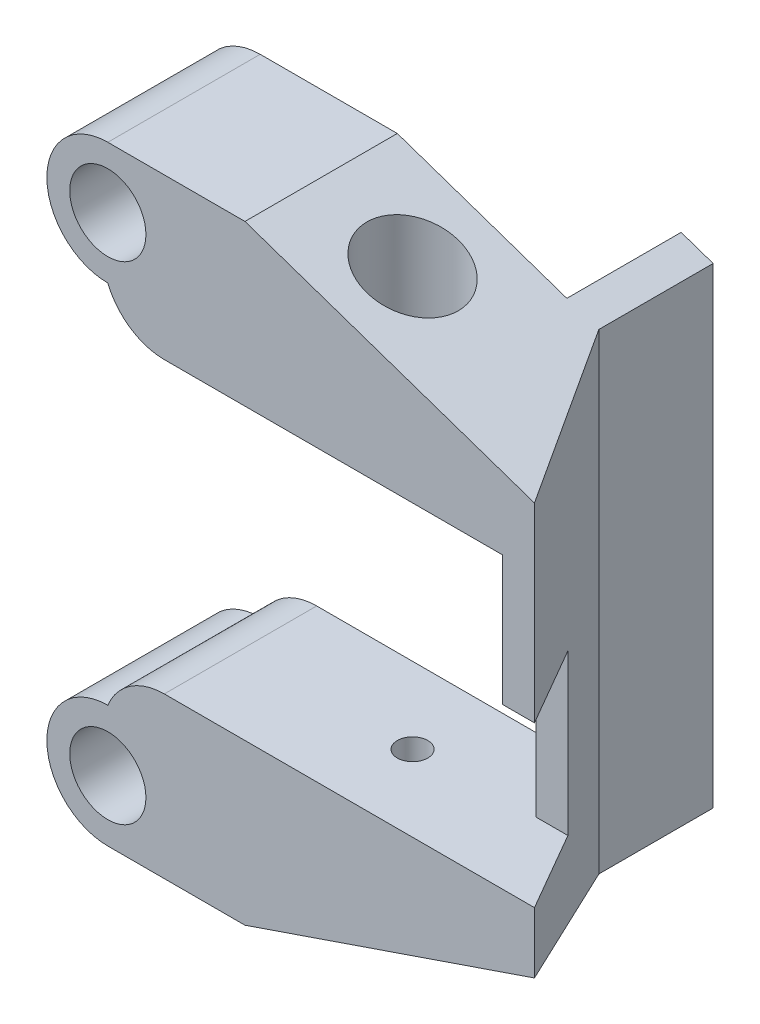
from build123d import *

# Parameters (mm, degrees)
CROQUIS1_R              = 2.5
SALIENTE_EXTRUIR1_DEPTH = 10
CROQUIS2_R              = 1
CORTAR_EXTRUIR1_DEPTH   = 4
SALIENTE_EXTRUIR2_DEPTH = 13.5
CROQUIS4_R              = 3
CORTAR_EXTRUIR2_DEPTH   = 1
SALIENTE_EXTRUIR3_START = 6.5
CROQUIS6_R              = 3
SALIENTE_EXTRUIR3_DEPTH = 6.5
CORTAR_EXTRUIR4_DEPTH   = 10
SALIENTE_EXTRUIR4_DEPTH = 7.5
CROQUIS5_W              = 2.1
CROQUIS5_H              = 10.5
CORTAR_EXTRUIR5_DEPTH   = 6
REDONDEO1_R             = 4
CORTAR_EXTRUIR6_DEPTH   = 1


with BuildPart() as part:
    # Croquis1 → Saliente-Extruir1 (new body)
    with BuildSketch(Plane.XY):
        with BuildLine():
            Line((-103.231635218, 22.700651543), (-131.231635218, 22.700651543))
            Line((-131.231635218, 22.700651543), (-131.231635218, 20.200651543))
            ThreePointArc((-131.231635218, 20.200651543), (-135.231635218, 16.200651543), (-131.231635218, 12.200651543))
            Line((-131.231635218, 12.200651543), (-125.231635218, 12.200651543))
            Line((-125.231635218, 12.200651543), (-125.231635218, 18.700651543))
            Line((-125.231635218, 18.700651543), (-103.231635218, 18.700651543))
            Line((-103.231635218, 18.700651543), (-103.231635218, 22.700651543))
        make_face()
        with Locations((-131.231635218, 16.200651543)):
            Circle(CROQUIS1_R, mode=Mode.SUBTRACT)
    extrude(amount=SALIENTE_EXTRUIR1_DEPTH)

    # Croquis2 → Cortar-Extruir1 (cut)
    with BuildSketch(Plane.XZ.offset(-18.700651543)):
        with Locations(Location((-116.231635218, 5, 0), (0, 0, 270))):
            Circle(CROQUIS2_R)
        Polygon((-103.231635218, 0), (-103.231635218, 10), (-109.00513791, 0), align=None)
    extrude(amount=-CORTAR_EXTRUIR1_DEPTH, mode=Mode.SUBTRACT)

    # Croquis3 → Saliente-Extruir2 (add)
    with BuildSketch(Plane.XZ.offset(-18.700651543)):
        Polygon((-103.231635218, 10), (-105.331635218, 10), (-111.10513791, 0), (-109.00513791, 0), align=None)
    extrude(amount=-SALIENTE_EXTRUIR2_DEPTH)

    # Croquis4 → Cortar-Extruir2 (cut)
    with BuildSketch(Plane.XZ.offset(-18.700651543)):
        with Locations(Location((-116.231635218, 5, 0), (0, 0, 270))):
            Circle(CROQUIS4_R)
    extrude(amount=-CORTAR_EXTRUIR2_DEPTH, mode=Mode.SUBTRACT)

    # Croquis6 → Saliente-Extruir3 (add)
    with BuildSketch(Plane.XZ.offset(-18.700651543).offset(SALIENTE_EXTRUIR3_START)):
        Polygon((-125.231635218, 10), (-103.231635218, 10), (-109.00513791, 0), (-125.231635218, 0), align=None)
        with Locations(Location((-116.231635218, 5, 0), (0, 0, 270))):
            Circle(CROQUIS6_R, mode=Mode.SUBTRACT)
    extrude(amount=-SALIENTE_EXTRUIR3_DEPTH)

    # Croquis7 → Cortar-Extruir4 (cut)
    with BuildSketch(Plane.XY.offset(10)):
        Polygon((-103.231635218, 18.700651543), (-103.231635218, 12.200651543), (-122.231635218, 12.200651543), align=None)
    extrude(amount=-CORTAR_EXTRUIR4_DEPTH, mode=Mode.SUBTRACT)

    # Croquis8 → Saliente-Extruir4 (add)
    with BuildSketch(Plane(origin=(0, 0, 0), x_dir=(-1, 0, 0), z_dir=(0, 0, -1))):
        Polygon((109.00513791, 16.725505885), (109.00513791, 32.200651543), (111.10513791, 32.200651543), (111.10513791, 22.700651543), (111.10513791, 16.007084832), align=None)
    extrude(amount=SALIENTE_EXTRUIR4_DEPTH)

    # Simetría1: part across plane


with BuildPart() as part_1:
    add(part.part)
    add(part.part.mirror(Plane(origin=(0, 32.200651543, 0), x_dir=(0, 0, 1), z_dir=(0, -1, 0))))

    # Croquis5 → Cortar-Extruir5 (cut, along a direction that is not the sketch's normal)
    with BuildSketch(Plane.XY.offset(10)):
        with Locations((-104.281635218, 27.950651543)):
            Rectangle(CROQUIS5_W, CROQUIS5_H)
    extrude(amount=-CORTAR_EXTRUIR5_DEPTH, dir=(0.49999999999999517, 0, 0.8660254037844416), mode=Mode.SUBTRACT)

    # Redondeo1
    # the kernel refuses this fillet: 4 mm, written as the material it takes off along each edge
    with BuildSketch(Plane(origin=(-131.231635218, 41.700651543, -9.270248109), x_dir=(1, 0, 0), z_dir=(0, 0, 1))) as redondeo1_piece_1:
        with BuildLine():
            CenterArc((3.708099244, 4), REDONDEO1_R, 202.024312837, 67.975687163)
            Line((0, 2.5), (-0.074161985, 2.47))
            ThreePointArc((-0.074161985, 2.47), (-0.08, 1.25), (-0.08, 0))
            Line((-0.08, 0), (0, -0.08))
            Line((0, -0.08), (3.708099244, -0.08))
            Line((3.708099244, -0.08), (3.708099244, 0))
        make_face()
    extrude(amount=28.540496218, mode=Mode.SUBTRACT)
    with BuildSketch(Plane(origin=(-131.231635218, 22.700651543, -9.270248109), x_dir=(0, -1, 0), z_dir=(0, 0, 1))) as redondeo1_piece_2:
        with BuildLine():
            CenterArc((4, 3.708099244), REDONDEO1_R, 180, 67.975687163)
            Line((0, 3.708099244), (-0.08, 3.708099244))
            Line((-0.08, 3.708099244), (-0.08, 0))
            Line((-0.08, 0), (0, -0.08))
            ThreePointArc((0, -0.08), (1.25, -0.08), (2.47, -0.074161985))
            Line((2.47, -0.074161985), (2.5, 0))
        make_face()
    extrude(amount=28.540496218, mode=Mode.SUBTRACT)

    # Croquis9 → Cortar-Extruir6 (cut)
    # profile 1 of 3: a face of its own
    with BuildSketch(Plane.XZ.offset(-12.200651543)):
        with BuildLine():
            Line((-129.629918872, 5.935122427), (-129.944021436, 5.935122427))
            add(Edge.make_bspline(
                [(-129.944021436, 5.935122427), (-129.938883042, 5.964665651), (-129.928758908, 6.02287442), (-129.905688863, 6.107276322), (-129.874967246, 6.187004747), (-129.83900153, 6.263031642), (-129.794886252, 6.333998224), (-129.74528823, 6.401172673), (-129.687657927, 6.462870513), (-129.62507573, 6.520799641), (-129.557590268, 6.57340625), (-129.485484513, 6.618077576), (-129.410971743, 6.65712632), (-129.33308236, 6.688820457), (-129.251878521, 6.712367599), (-129.168264744, 6.730083696), (-129.081456362, 6.740880916), (-129.022544442, 6.742163029), (-128.99259916, 6.742814735)],
                knots=[0, 0, 0, 0, 1.053304757, 2.075317675, 3.068179183, 4.052514018, 5.025721787, 5.999656851, 6.981831287, 7.987213101, 8.994102963, 9.982949043, 10.963611807, 11.947192756, 12.931972798, 13.930523328, 14.948072636, 16, 16, 16, 16], degree=3))
            add(Edge.make_bspline(
                [(-128.99259916, 6.742814735), (-128.96100797, 6.741994513), (-128.898998671, 6.740384525), (-128.808193364, 6.728082177), (-128.721593422, 6.708894122), (-128.639379859, 6.68043288), (-128.561767782, 6.643941332), (-128.487896037, 6.599988506), (-128.418237898, 6.548176568), (-128.354426012, 6.487683305), (-128.295418928, 6.422247703), (-128.243758511, 6.351249252), (-128.201485798, 6.274965016), (-128.164802669, 6.195422432), (-128.13779643, 6.110566672), (-128.118009085, 6.021431014), (-128.106974188, 5.927685157), (-128.1051879, 5.86386874), (-128.104277846, 5.831356402)],
                knots=[0, 0, 0, 0, 1.062315377, 2.085183558, 3.076853664, 4.041450855, 5.005054491, 5.956881831, 6.928532668, 7.918549963, 8.909565511, 9.889228988, 10.864308296, 11.838912148, 12.830831495, 13.853185998, 14.906269772, 16, 16, 16, 16], degree=3))
            add(Edge.make_bspline(
                [(-128.104277846, 5.831356402), (-128.105740586, 5.788957882), (-128.108582872, 5.706572285), (-128.131064334, 5.587863343), (-128.169300869, 5.478866679), (-128.214016218, 5.395753244), (-128.258483191, 5.334384337), (-128.297300103, 5.289484954), (-128.341464007, 5.24529324), (-128.391466505, 5.202513595), (-128.447199469, 5.161152722), (-128.508257397, 5.12080561), (-128.574241111, 5.08021957), (-128.621303445, 5.055848386), (-128.645543872, 5.043295504)],
                knots=[0, 0, 0, 0, 1.499598844, 2.913907084, 4.255683563, 5.573052951, 6.236393449, 6.934250511, 7.671053759, 8.445154725, 9.260560518, 10.125260916, 11.034376938, 12, 12, 12, 12], degree=3))
            add(Edge.make_bspline(
                [(-128.645543872, 5.043295504), (-128.609624273, 5.018890314), (-128.539462046, 4.971219334), (-128.446945169, 4.887112245), (-128.369318843, 4.795026922), (-128.304333176, 4.696406998), (-128.255285105, 4.589069905), (-128.219110852, 4.474759076), (-128.197888084, 4.35254157), (-128.195328604, 4.268638268), (-128.194021436, 4.225787491)],
                knots=[0, 0, 0, 0, 1.064624726, 2.079545519, 3.056122326, 4.013672591, 4.968126873, 5.942090367, 6.948992187, 8, 8, 8, 8], degree=3))
            add(Edge.make_bspline(
                [(-128.194021436, 4.225787491), (-128.195906334, 4.17446935), (-128.199629042, 4.073115064), (-128.229453505, 3.924004613), (-128.278213334, 3.780815095), (-128.345370536, 3.644177702), (-128.43022182, 3.517535509), (-128.530361177, 3.402664729), (-128.646540118, 3.302605755), (-128.775951959, 3.217421647), (-128.915393941, 3.148907903), (-129.061941253, 3.099425805), (-129.214050576, 3.068810758), (-129.317544229, 3.065167298), (-129.369802686, 3.063327556)],
                knots=[0, 0, 0, 0, 1.004874671, 1.984646221, 2.966438109, 3.961709977, 4.958676373, 5.945134406, 6.938497793, 7.953256374, 8.973116323, 9.973725145, 10.976845487, 12, 12, 12, 12], degree=3))
            add(Edge.make_bspline(
                [(-129.369802686, 3.063327556), (-129.403024527, 3.064164518), (-129.468283499, 3.065808596), (-129.564297919, 3.077931179), (-129.656379342, 3.098103693), (-129.744676638, 3.127068828), (-129.828882177, 3.164362015), (-129.909517526, 3.209514249), (-129.985885063, 3.263035151), (-130.05829591, 3.323914324), (-130.124708683, 3.392559281), (-130.184585111, 3.467937946), (-130.237361729, 3.549686336), (-130.282974099, 3.637768075), (-130.32167056, 3.731793837), (-130.352227335, 3.832405381), (-130.377195269, 3.938922482), (-130.387483257, 4.012775547), (-130.392739385, 4.050507043)],
                knots=[0, 0, 0, 0, 1.015592156, 1.994967694, 2.953714725, 3.89374535, 4.831137841, 5.76533834, 6.714853956, 7.678276274, 8.653576723, 9.630054425, 10.617115938, 11.623871201, 12.658910274, 13.721192194, 14.835758172, 16, 16, 16, 16], degree=3))
            Line((-130.392739385, 4.050507043), (-130.078636821, 4.050507043))
            add(Edge.make_bspline(
                [(-130.078636821, 4.050507043), (-130.071817316, 4.011337383), (-130.058965267, 3.937518181), (-130.030843292, 3.835188084), (-129.997903045, 3.747213231), (-129.957156351, 3.67270531), (-129.90768096, 3.60887334), (-129.849073899, 3.552813239), (-129.780527485, 3.502546723), (-129.703885102, 3.458636867), (-129.621209749, 3.421740201), (-129.534607726, 3.397536002), (-129.446716354, 3.379693518), (-129.387189113, 3.378188681), (-129.357182494, 3.37743012)],
                knots=[0, 0, 0, 0, 1.310091687, 2.469000878, 3.493463796, 4.400459837, 5.257309936, 6.145490497, 7.065451012, 8.052643887, 9.053215749, 10.040649124, 11.012326184, 12, 12, 12, 12], degree=3))
            add(Edge.make_bspline(
                [(-129.357182494, 3.37743012), (-129.330259871, 3.378259293), (-129.277083775, 3.37989703), (-129.198406779, 3.392370589), (-129.121840554, 3.411955838), (-129.046940427, 3.439301399), (-128.97450054, 3.475723737), (-128.9035768, 3.518933574), (-128.835320775, 3.570956375), (-128.769362567, 3.62897648), (-128.708788832, 3.692455272), (-128.655043055, 3.758415554), (-128.609885092, 3.826322221), (-128.571973544, 3.895642435), (-128.544515813, 3.967894654), (-128.522646763, 4.040786693), (-128.510740558, 4.116022853), (-128.509001035, 4.166622349), (-128.508124, 4.192133645)],
                knots=[0, 0, 0, 0, 0.998765887, 1.972707914, 2.948771611, 3.928374012, 4.925217491, 5.953083336, 7.006002037, 8.105848567, 9.210029586, 10.258437752, 11.259122355, 12.233064382, 13.183315866, 14.122098927, 15.053198292, 16, 16, 16, 16], degree=3))
            add(Edge.make_bspline(
                [(-128.508124, 4.192133645), (-128.50933446, 4.224937482), (-128.511732813, 4.28993358), (-128.530966564, 4.385246302), (-128.563942253, 4.476097655), (-128.608603591, 4.562148174), (-128.66502214, 4.641710436), (-128.734172745, 4.710904056), (-128.813610828, 4.770806342), (-128.905488395, 4.819359607), (-129.010211791, 4.857362123), (-129.128870907, 4.884243366), (-129.262337384, 4.900087257), (-129.356201671, 4.902042819), (-129.405559898, 4.903071145)],
                knots=[0, 0, 0, 0, 0.91172544, 1.806453237, 2.690400502, 3.591501907, 4.495060705, 5.391179975, 6.301027311, 7.251780241, 8.269539355, 9.39038931, 10.627744823, 12, 12, 12, 12], degree=3))
            Line((-129.405559898, 4.903071145), (-129.367699321, 5.217173709))
            Line((-129.367699321, 5.217173709), (-129.275151244, 5.214369222))
            add(Edge.make_bspline(
                [(-129.275151244, 5.214369222), (-129.244045513, 5.214835142), (-129.183095607, 5.215748085), (-129.093779738, 5.225040347), (-129.008955897, 5.240395569), (-128.928749103, 5.261398134), (-128.853234664, 5.287877039), (-128.782576856, 5.321092986), (-128.716565385, 5.3605969), (-128.655172607, 5.40502628), (-128.599942334, 5.45405434), (-128.551350696, 5.505773723), (-128.510265765, 5.560330183), (-128.476330401, 5.616769912), (-128.451011774, 5.676196456), (-128.431790399, 5.737127962), (-128.420167179, 5.801000612), (-128.418981796, 5.844396342), (-128.41838041, 5.866412491)],
                knots=[0, 0, 0, 0, 1.24628212, 2.442018811, 3.593922291, 4.698034728, 5.761554064, 6.796478033, 7.821307851, 8.840472263, 9.829094753, 10.776759556, 11.679673515, 12.561550013, 13.408929098, 14.262137482, 15.118322481, 16, 16, 16, 16], degree=3))
            add(Edge.make_bspline(
                [(-128.41838041, 5.866412491), (-128.418977739, 5.885829602), (-128.420148429, 5.923884725), (-128.427649874, 5.97997183), (-128.442105983, 6.033363927), (-128.460924215, 6.084607044), (-128.484841589, 6.133827975), (-128.515461512, 6.179872626), (-128.550600406, 6.224473146), (-128.591139948, 6.266115067), (-128.635341601, 6.304338892), (-128.682714244, 6.337427885), (-128.732136821, 6.365778381), (-128.784164026, 6.389161078), (-128.839296799, 6.406557697), (-128.896801024, 6.419069311), (-128.956623942, 6.427007735), (-128.997248746, 6.428138858), (-129.017839545, 6.428712171)],
                knots=[0, 0, 0, 0, 1.017722485, 1.994609554, 2.957110515, 3.910372255, 4.852475095, 5.817233168, 6.802300924, 7.824362143, 8.857880086, 9.860231714, 10.847656914, 11.840006958, 12.84318132, 13.87138813, 14.921106966, 16, 16, 16, 16], degree=3))
            add(Edge.make_bspline(
                [(-129.017839545, 6.428712171), (-129.055613795, 6.427179704), (-129.129480711, 6.424182991), (-129.236059233, 6.398210301), (-129.334481261, 6.355534619), (-129.423318067, 6.296764979), (-129.500130155, 6.22388643), (-129.561534995, 6.138410596), (-129.606003859, 6.041072772), (-129.621814699, 5.971026229), (-129.629918872, 5.935122427)],
                knots=[0, 0, 0, 0, 1.055739269, 2.064480543, 3.048501583, 4.044208126, 5.029380081, 5.994799901, 6.972193286, 8, 8, 8, 8], degree=3))
        make_face()
    # profile 2 of 3: a face of its own
    with BuildSketch(Plane.XZ.offset(-12.200651543)):
        with BuildLine():
            add(Edge.make_bspline(
                [(-126.213352365, 6.742814735), (-126.180797518, 6.741726444), (-126.116682954, 6.739583128), (-126.022772694, 6.722916164), (-125.932743195, 6.696257222), (-125.846964239, 6.658291313), (-125.765597642, 6.608811048), (-125.687281587, 6.550199004), (-125.614450609, 6.478884275), (-125.545024378, 6.39870883), (-125.481810966, 6.3082755), (-125.427271441, 6.207862717), (-125.379937411, 6.09895601), (-125.342451397, 5.980423247), (-125.313163233, 5.853320752), (-125.292324082, 5.717170519), (-125.279620436, 5.572184447), (-125.278123204, 5.472408758), (-125.277354769, 5.421200152)],
                knots=[0, 0, 0, 0, 0.862726717, 1.699081786, 2.520498053, 3.347202637, 4.178215295, 5.040763974, 5.93476699, 6.875030527, 7.849681161, 8.853576535, 9.899908318, 10.99336013, 12.144709661, 13.354978701, 14.642476391, 16, 16, 16, 16], degree=3))
            add(Edge.make_bspline(
                [(-125.277354769, 5.421200152), (-125.277984269, 5.361586296), (-125.279226989, 5.243900254), (-125.290416101, 5.069693697), (-125.306467369, 4.899971063), (-125.331513856, 4.735163148), (-125.362089268, 4.574816733), (-125.399926034, 4.419189021), (-125.44471544, 4.2682029), (-125.496543843, 4.12308947), (-125.552873529, 3.985719601), (-125.611575664, 3.857140159), (-125.674111052, 3.739699546), (-125.738135084, 3.631547219), (-125.806694659, 3.53495285), (-125.876114822, 3.44708108), (-125.950385591, 3.371372571), (-126.026251987, 3.304862263), (-126.104605322, 3.248110549), (-126.183896628, 3.198584729), (-126.264835972, 3.157483581), (-126.34640228, 3.122180074), (-126.430291614, 3.096629491), (-126.515139043, 3.077794289), (-126.601382562, 3.064910704), (-126.659453029, 3.063857987), (-126.688712942, 3.063327556)],
                knots=[0, 0, 0, 0, 1.417840176, 2.799013713, 4.150912842, 5.471708405, 6.7625667, 8.032669517, 9.279703417, 10.506991142, 11.696233478, 12.810550062, 13.867435083, 14.859899853, 15.797607937, 16.683162267, 17.520520521, 18.316460938, 19.08034531, 19.819286053, 20.537807717, 21.237833669, 21.930604121, 22.619796651, 23.304558187, 24, 24, 24, 24], degree=3))
            add(Edge.make_bspline(
                [(-126.688712942, 3.063327556), (-126.731859219, 3.065044717), (-126.816436198, 3.068410762), (-126.939210378, 3.095943779), (-127.054147511, 3.140450299), (-127.14307278, 3.19208983), (-127.208875967, 3.242310743), (-127.256263455, 3.28449598), (-127.30028989, 3.331866165), (-127.342393901, 3.383171089), (-127.382673707, 3.438607245), (-127.419667, 3.499336782), (-127.454699442, 3.564331505), (-127.486956999, 3.634110905), (-127.516781404, 3.708513065), (-127.541746727, 3.788508296), (-127.562696585, 3.873798171), (-127.580033682, 3.964151642), (-127.594168166, 4.059560399), (-127.603867478, 4.160179384), (-127.609363802, 4.266156656), (-127.610239316, 4.338661666), (-127.610688103, 4.375827556)],
                knots=[0, 0, 0, 0, 1.435486142, 2.813894703, 4.16658029, 5.526677663, 6.22086169, 6.92078, 7.636484549, 8.371846828, 9.129958256, 9.916110108, 10.737818826, 11.587357994, 12.474660306, 13.405010476, 14.375161658, 15.397738152, 16.467494513, 17.58566334, 18.762416952, 20, 20, 20, 20], degree=3))
            add(Edge.make_bspline(
                [(-127.610688103, 4.375827556), (-127.609991708, 4.437773738), (-127.608621684, 4.559641026), (-127.598496755, 4.739482967), (-127.582748382, 4.913320139), (-127.559783578, 5.081112769), (-127.529178032, 5.242589405), (-127.493892271, 5.398620353), (-127.451246792, 5.548716048), (-127.401390404, 5.69193009), (-127.347097787, 5.827064754), (-127.289476938, 5.953261854), (-127.228947366, 6.06968959), (-127.164375266, 6.175686932), (-127.097024301, 6.271783444), (-127.026076432, 6.357453873), (-126.952395959, 6.433879707), (-126.875070153, 6.499924918), (-126.795243658, 6.55634878), (-126.715576337, 6.606980695), (-126.633716134, 6.648013436), (-126.551685988, 6.682778182), (-126.468430587, 6.709760334), (-126.384103766, 6.728276351), (-126.299051801, 6.741180811), (-126.241912142, 6.742270221), (-126.213352365, 6.742814735)],
                knots=[0, 0, 0, 0, 1.470791388, 2.893501234, 4.275600723, 5.614434664, 6.912857095, 8.17686219, 9.411686231, 10.615561684, 11.775855534, 12.868421853, 13.908428417, 14.889627493, 15.813393228, 16.692284126, 17.528148069, 18.331072678, 19.102586731, 19.8478506, 20.570031765, 21.273923614, 21.961841481, 22.644389209, 23.322433117, 24, 24, 24, 24], degree=3))
        make_face()
        with BuildLine():
            add(Edge.make_bspline(
                [(-126.237190507, 6.428712171), (-126.256164983, 6.427992099), (-126.294358685, 6.426542668), (-126.351869433, 6.416003702), (-126.410240191, 6.400064228), (-126.469528349, 6.376439867), (-126.529308091, 6.346217794), (-126.590337366, 6.310086499), (-126.651886062, 6.26713521), (-126.714332452, 6.217707254), (-126.775500879, 6.159952162), (-126.834402798, 6.0938486), (-126.890735719, 6.019086986), (-126.943821383, 5.935086862), (-126.995083532, 5.842486416), (-127.043137957, 5.740699612), (-127.088656552, 5.630452607), (-127.131216072, 5.512076181), (-127.170562136, 5.386651003), (-127.203910663, 5.254304459), (-127.232878948, 5.11636026), (-127.255387319, 4.972107507), (-127.274999653, 4.822353935), (-127.286869688, 4.666477133), (-127.294937628, 4.504919463), (-127.296029433, 4.39523592), (-127.296585539, 4.339369222)],
                knots=[0, 0, 0, 0, 0.535590216, 1.078088953, 1.646503504, 2.242120821, 2.876684528, 3.536551845, 4.243209066, 4.994585865, 5.783597611, 6.615574094, 7.492013341, 8.4238755, 9.419375135, 10.479150357, 11.600588305, 12.786362483, 14.030464638, 15.311003394, 16.63899601, 18.009344201, 19.432868756, 20.902802065, 22.422459604, 24, 24, 24, 24], degree=3))
            add(Edge.make_bspline(
                [(-127.296585539, 4.339369222), (-127.296120216, 4.299852094), (-127.295221473, 4.223527017), (-127.286274934, 4.112888047), (-127.273905667, 4.009885164), (-127.253893309, 3.915135034), (-127.229797809, 3.827846664), (-127.198906748, 3.748868902), (-127.16326502, 3.677162272), (-127.121690392, 3.613923371), (-127.076070107, 3.558454371), (-127.027394987, 3.510295464), (-126.976041417, 3.469554092), (-126.922536234, 3.435290445), (-126.865938355, 3.409048603), (-126.806438651, 3.391004428), (-126.744568672, 3.37920329), (-126.702322105, 3.378024862), (-126.681000603, 3.37743012)],
                knots=[0, 0, 0, 0, 1.484932994, 2.868063245, 4.170070992, 5.381165891, 6.504504114, 7.56970386, 8.563591869, 9.508896032, 10.407542569, 11.258515368, 12.077514383, 12.867109075, 13.641358872, 14.41376278, 15.199438864, 16, 16, 16, 16], degree=3))
            add(Edge.make_bspline(
                [(-126.681000603, 3.37743012), (-126.658752316, 3.37805697), (-126.614204176, 3.379312124), (-126.547844481, 3.391033014), (-126.482404223, 3.410194114), (-126.417613058, 3.436322372), (-126.353339048, 3.469691619), (-126.289505764, 3.510200847), (-126.227163321, 3.559427525), (-126.164769482, 3.614324426), (-126.104494482, 3.676900987), (-126.047136632, 3.746309224), (-125.993059421, 3.822256271), (-125.942703504, 3.904722004), (-125.894898649, 3.993053538), (-125.850852789, 4.087945445), (-125.809994323, 4.189317053), (-125.786030237, 4.259785593), (-125.773749, 4.295899671)],
                knots=[0, 0, 0, 0, 0.77604706, 1.553892808, 2.343877876, 3.152800139, 3.98830987, 4.868615572, 5.78728157, 6.75807329, 7.767676272, 8.816335789, 9.898351881, 11.019038633, 12.187032868, 13.402327443, 14.668731489, 16, 16, 16, 16], degree=3))
            add(Edge.make_bspline(
                [(-125.773749, 4.295899671), (-125.759096604, 4.342289643), (-125.729674581, 4.435440746), (-125.692632591, 4.577683269), (-125.662231302, 4.722414468), (-125.635620693, 4.869110212), (-125.616693197, 5.018493173), (-125.601465814, 5.169937786), (-125.593105338, 5.323882212), (-125.592009729, 5.427267429), (-125.591457333, 5.479393261)],
                knots=[0, 0, 0, 0, 0.97088093, 1.949529747, 2.93210591, 3.92216045, 4.924261898, 5.936559817, 6.959633308, 8, 8, 8, 8], degree=3))
            add(Edge.make_bspline(
                [(-125.591457333, 5.479393261), (-125.591974363, 5.517735685), (-125.59297508, 5.59194797), (-125.601264203, 5.699705475), (-125.615889603, 5.799952108), (-125.636137449, 5.893013428), (-125.661823838, 5.978727824), (-125.693332905, 6.056982559), (-125.730551576, 6.127972401), (-125.774071688, 6.190927255), (-125.822001914, 6.246422735), (-125.872645382, 6.295086243), (-125.925746332, 6.337015076), (-125.982648858, 6.370058472), (-126.042076401, 6.396422287), (-126.104456085, 6.415226181), (-126.169906636, 6.426985834), (-126.21447032, 6.428129227), (-126.237190507, 6.428712171)],
                knots=[0, 0, 0, 0, 1.430250887, 2.768270117, 4.028380119, 5.206661668, 6.318152812, 7.362403216, 8.349129852, 9.30195703, 10.210727286, 11.080171321, 11.919002126, 12.727940788, 13.528188044, 14.339050687, 15.153187666, 16, 16, 16, 16], degree=3))
        make_face(mode=Mode.SUBTRACT)
    # profile 3 of 3: a face of its own
    with BuildSketch(Plane.XZ.offset(-12.200651543)):
        with BuildLine():
            add(Edge.make_bspline(
                [(-124.029357974, 6.742814735), (-124.00595609, 6.742086998), (-123.95964778, 6.740646933), (-123.891658642, 6.730852685), (-123.82649508, 6.713962722), (-123.764572233, 6.689837156), (-123.705040838, 6.659444936), (-123.648410055, 6.622297605), (-123.59456947, 6.578381446), (-123.544750948, 6.527991808), (-123.498041769, 6.473059851), (-123.458521116, 6.412319093), (-123.423489538, 6.348165269), (-123.39556943, 6.279483187), (-123.374671918, 6.206504341), (-123.359355757, 6.129598861), (-123.349038547, 6.048515284), (-123.348262502, 5.992880741), (-123.34786759, 5.964569543)],
                knots=[0, 0, 0, 0, 0.970717871, 1.920883944, 2.842680434, 3.757311267, 4.672198984, 5.610669493, 6.561577208, 7.54876171, 8.546788736, 9.547073532, 10.549095219, 11.575307918, 12.615394826, 13.693467145, 14.826256018, 16, 16, 16, 16], degree=3))
            add(Edge.make_bspline(
                [(-123.34786759, 5.964569543), (-123.348376243, 5.931574461), (-123.349371865, 5.866990869), (-123.362016533, 5.772531875), (-123.380793887, 5.682475499), (-123.406498463, 5.596277744), (-123.440971614, 5.514774698), (-123.483522882, 5.438049997), (-123.532520745, 5.365336911), (-123.589282732, 5.298463839), (-123.651365026, 5.237805281), (-123.717284449, 5.184089115), (-123.787396256, 5.138814454), (-123.860951139, 5.101675719), (-123.938211168, 5.072444382), (-124.018936882, 5.052374666), (-124.103302873, 5.040136287), (-124.160659585, 5.038513994), (-124.189914865, 5.03768653)],
                knots=[0, 0, 0, 0, 1.130854088, 2.213500164, 3.262022406, 4.283858738, 5.293169922, 6.29044296, 7.288617459, 8.29537939, 9.292942272, 10.261820963, 11.206697579, 12.149430033, 13.082848615, 14.033453143, 14.996945993, 16, 16, 16, 16], degree=3))
            add(Edge.make_bspline(
                [(-124.189914865, 5.03768653), (-124.213791247, 5.038368207), (-124.260581362, 5.039704077), (-124.329343517, 5.050007383), (-124.395316997, 5.065687036), (-124.458343598, 5.089126144), (-124.517786467, 5.119461779), (-124.574731264, 5.155686307), (-124.628799255, 5.198403939), (-124.678780515, 5.248051715), (-124.724387203, 5.302706781), (-124.764588814, 5.361734184), (-124.79844048, 5.425204149), (-124.825515805, 5.492835015), (-124.847509542, 5.563811254), (-124.862895712, 5.63893283), (-124.872110571, 5.718008189), (-124.873036843, 5.772203166), (-124.873508615, 5.799805921)],
                knots=[0, 0, 0, 0, 0.998939331, 1.957603429, 2.904214697, 3.832710991, 4.764499105, 5.69253155, 6.653438724, 7.642559757, 8.635735374, 9.628718291, 10.626459594, 11.640042448, 12.673490826, 13.732455774, 14.845087277, 16, 16, 16, 16], degree=3))
            add(Edge.make_bspline(
                [(-124.873508615, 5.799805921), (-124.872613732, 5.83302177), (-124.870862887, 5.898008731), (-124.859662031, 5.993574801), (-124.840146948, 6.084665839), (-124.812430422, 6.171331392), (-124.778311825, 6.254126123), (-124.735100015, 6.332136288), (-124.684408205, 6.40610516), (-124.626532821, 6.475042833), (-124.563225167, 6.537492539), (-124.496629303, 6.592985703), (-124.425814695, 6.638452658), (-124.352796103, 6.67676259), (-124.276393877, 6.706516284), (-124.19688792, 6.727396929), (-124.114161037, 6.740515195), (-124.05791958, 6.742040252), (-124.029357974, 6.742814735)],
                knots=[0, 0, 0, 0, 1.130922342, 2.21265473, 3.270805013, 4.297553847, 5.306888354, 6.314716204, 7.327776304, 8.355757729, 9.374178632, 10.352259942, 11.301297143, 12.233743801, 13.155811409, 14.086116658, 15.028055401, 16, 16, 16, 16], degree=3))
        make_face()
        with BuildLine():
            add(Edge.make_bspline(
                [(-124.041277045, 6.473583966), (-124.065437173, 6.472716923), (-124.113559402, 6.470989944), (-124.184824542, 6.454520312), (-124.2545212, 6.428648356), (-124.321483153, 6.391898253), (-124.384623611, 6.346969267), (-124.440661172, 6.291774464), (-124.490205968, 6.228415636), (-124.530975697, 6.156091368), (-124.564069486, 6.077829892), (-124.587147294, 5.993906593), (-124.60142672, 5.905463433), (-124.603316297, 5.844732493), (-124.604277846, 5.813828357)],
                knots=[0, 0, 0, 0, 0.898823508, 1.790279833, 2.710439412, 3.660988812, 4.627551506, 5.588017192, 6.580694835, 7.614151002, 8.671642138, 9.738410943, 10.84914581, 12, 12, 12, 12], degree=3))
            add(Edge.make_bspline(
                [(-124.604277846, 5.813828357), (-124.602911126, 5.777248126), (-124.600287369, 5.707023355), (-124.577177406, 5.60714081), (-124.537158391, 5.519257323), (-124.483253304, 5.443461721), (-124.416306256, 5.383106), (-124.340488231, 5.338225557), (-124.25572304, 5.311263624), (-124.196418801, 5.308388375), (-124.166076724, 5.306917299)],
                knots=[0, 0, 0, 0, 1.167761783, 2.24180663, 3.250972385, 4.235329223, 5.192198183, 6.109164403, 7.032583837, 8, 8, 8, 8], degree=3))
            add(Edge.make_bspline(
                [(-124.166076724, 5.306917299), (-124.145940954, 5.307369211), (-124.106618138, 5.308251743), (-124.048967082, 5.317748153), (-123.994453304, 5.333130826), (-123.942653176, 5.354061025), (-123.894410532, 5.382107012), (-123.848932928, 5.415621303), (-123.806391199, 5.455422082), (-123.767650427, 5.500919394), (-123.732229586, 5.550170399), (-123.701071658, 5.602387337), (-123.674964871, 5.657309503), (-123.654378424, 5.714791993), (-123.637025457, 5.774140554), (-123.625316074, 5.836116623), (-123.618114934, 5.900594048), (-123.617440221, 5.944451366), (-123.617098359, 5.966672908)],
                knots=[0, 0, 0, 0, 1.007750251, 1.968018882, 2.916659645, 3.840494567, 4.758079246, 5.703899357, 6.664595947, 7.668873183, 8.692139613, 9.699889865, 10.710423493, 11.732484109, 12.755080818, 13.804198226, 14.88743536, 16, 16, 16, 16], degree=3))
            add(Edge.make_bspline(
                [(-123.617098359, 5.966672908), (-123.61839354, 6.003977096), (-123.620865503, 6.075175285), (-123.644524836, 6.175534778), (-123.682255418, 6.264360974), (-123.73684158, 6.338431176), (-123.80129501, 6.398605059), (-123.87434795, 6.442841461), (-123.955642403, 6.469018067), (-124.01234289, 6.472041244), (-124.041277045, 6.473583966)],
                knots=[0, 0, 0, 0, 1.207628711, 2.304861276, 3.322697533, 4.315405203, 5.264472711, 6.164993415, 7.063599473, 8, 8, 8, 8], degree=3))
        make_face(mode=Mode.SUBTRACT)
    extrude(amount=-CORTAR_EXTRUIR6_DEPTH, mode=Mode.SUBTRACT)


solid = part_1.part
